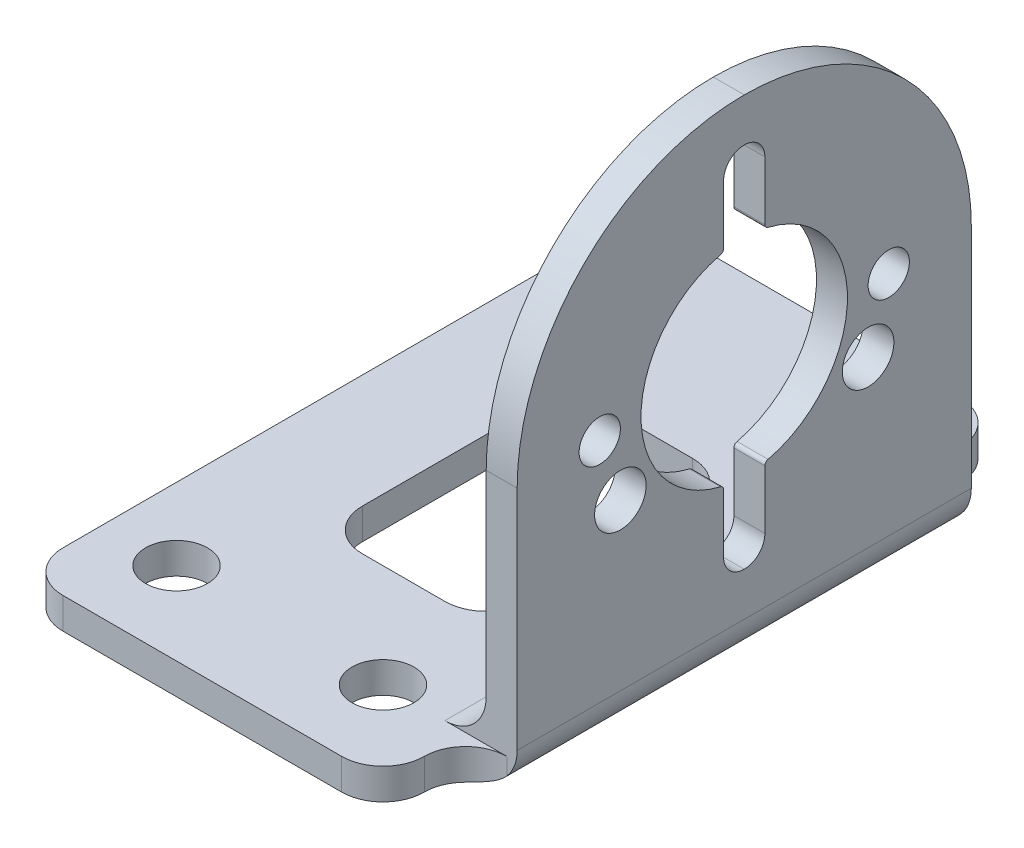
from build123d import *

# Parameters (mm, degrees)
EXTRUDE_1_DEPTH          = 30
CUT_EXTRUDE_1_DEPTH      = 30
CUT_EXTRUDE_1_DEPTH_BACK = 30
SKETCH_2_W               = 4.827470223
SKETCH_2_H               = 5.659354242
FILLET_1_R               = 11
SKETCH_3_R               = 1.5
CUT_EXTRUDE_2_DEPTH      = 30
SKETCH_4_R               = 1
SKETCH_4_R_2             = 1.25
CUT_EXTRUDE_3_DEPTH      = 43.640942766
FILLET_2_R               = 1
FILLET_3_R               = 0.2
FILLET_4_R               = 2
FILLET_5_R               = 2


# Some blends are built 0.0001 mm under size
with BuildPart() as part:
    # 草图1 → 凸台-拉伸1 (new body)
    with BuildSketch(Plane.XY):
        Polygon((0, 0), (18.5, 0), (20, 0), (20, 24), (18.5, 24), (18.5, 1.5), (0, 1.5), align=None)
    extrude(amount=EXTRUDE_1_DEPTH)

    # 草图2 → 切除-拉伸1 (cut, two sides: drawn at the far end of the back side and taken through both)
    with BuildSketch(Plane(origin=(0, 1.5, 0), x_dir=(1, 0, 0), z_dir=(0, 1, 0)).offset(-CUT_EXTRUDE_1_DEPTH_BACK)):
        with Locations((19.913735112, -1.170322879)):
            Rectangle(SKETCH_2_W, SKETCH_2_H)
        with Locations((19.913735112, -28.829677121)):
            Rectangle(SKETCH_2_W, SKETCH_2_H)
    extrude(amount=CUT_EXTRUDE_1_DEPTH + CUT_EXTRUDE_1_DEPTH_BACK, mode=Mode.SUBTRACT)

    # 圆角1
    fillet_1_edges = [part.edges().sort_by_distance(p)[0] for p in [
        (19.25, 24, 26),
        (19.25, 24, 4),
    ]]
    fillet(fillet_1_edges, radius=FILLET_1_R - 0.0001)  # a hair under: the kernel refuses the full size

    # 草图3 → 切除-拉伸2 (cut)
    with BuildSketch(Plane(origin=(0, 1.5, 0), x_dir=(1, 0, 0), z_dir=(0, 1, 0))):
        with Locations(Location((13.5, -4, 0), (0, 0, 270))):
            Circle(SKETCH_3_R)
        with Locations(Location((3.5, -4, 0), (0, 0, 270))):
            Circle(SKETCH_3_R)
        with Locations(Location((3.5, -26, 0), (0, 0, 270))):
            Circle(SKETCH_3_R)
        with Locations(Location((13.5, -26, 0), (0, 0, 270))):
            Circle(SKETCH_3_R)
        with BuildLine():
            Line((7.5, -9), (11.5, -9))
            ThreePointArc((11.5, -9), (12.914213562, -9.585786438), (13.5, -11))
            Line((13.5, -11), (13.5, -19))
            ThreePointArc((13.5, -19), (12.914213562, -20.414213562), (11.5, -21))
            Line((11.5, -21), (7.5, -21))
            ThreePointArc((7.5, -21), (6.085786438, -20.414213562), (5.5, -19))
            Line((5.5, -19), (5.5, -11))
            ThreePointArc((5.5, -11), (6.085786438, -9.585786438), (7.5, -9))
        make_face()
    extrude(amount=-CUT_EXTRUDE_2_DEPTH, mode=Mode.SUBTRACT)

    # 草图4 → 切除-拉伸3 (cut, through all)
    with BuildSketch(Plane.ZY.offset(-18.5)):
        with Locations((8, 13)):
            Circle(SKETCH_4_R)
        with Locations(Location((22, 13, 0), (0, 0, 180))):
            Circle(SKETCH_4_R)
        with Locations((9, 10)):
            Circle(SKETCH_4_R_2)
        with Locations(Location((21, 10, 0), (0, 0, 180))):
            Circle(SKETCH_4_R_2)
        with BuildLine():
            Line((16, 8.101020514), (16, 4.101020514))
            Line((16, 4.101020514), (14, 4.101020514))
            Line((14, 4.101020514), (14, 8.101020514))
            ThreePointArc((14, 8.101020514), (10, 13), (14, 17.898979486))
            Line((14, 17.898979486), (14, 21.898979486))
            Line((14, 21.898979486), (16, 21.898979486))
            Line((16, 21.898979486), (16, 17.898979486))
            ThreePointArc((16, 17.898979486), (20, 13), (16, 8.101020514))
        make_face()
    extrude(amount=-CUT_EXTRUDE_3_DEPTH, mode=Mode.SUBTRACT)

    # 圆角2
    fillet_2_edges = [part.edges().sort_by_distance(p)[0] for p in [
        (19.25, 4.101020514, 14),
        (19.25, 4.101020514, 16),
        (19.25, 21.898979486, 16),
        (19.25, 21.898979486, 14),
    ]]
    fillet(fillet_2_edges, radius=FILLET_2_R - 0.0001)  # a hair under: the kernel refuses the full size

    # 圆角3
    fillet_3_edges = [part.edges().sort_by_distance(p)[0] for p in [
        (19.25, 8.101020514, 14),
        (19.25, 17.898979486, 14),
        (19.25, 17.898979486, 16),
        (19.25, 8.101020514, 16),
    ]]
    fillet(fillet_3_edges, radius=FILLET_3_R)

    # 圆角4
    # the kernel refuses this fillet: 2 mm, written as the material it adds along each edge
    with BuildSketch(Plane(origin=(17.5, 0, 26), x_dir=(1, 0, 0), z_dir=(0, 1, 0))) as fillet_4_piece_1:
        with BuildLine():
            CenterArc((FILLET_4_R, -FILLET_4_R), FILLET_4_R, 90, 90)
            Line((0, -FILLET_4_R), (0, 0))
            Line((0, 0), (FILLET_4_R, 0))
        make_face()
    extrude(amount=1.5)
    with BuildSketch(Plane(origin=(17.5, 0, 4), x_dir=(1, 0, 0), z_dir=(0, 1, 0))) as fillet_4_piece_2:
        with BuildLine():
            CenterArc((FILLET_4_R, FILLET_4_R), FILLET_4_R, 180, 90)
            Line((0, FILLET_4_R), (0, 0))
            Line((0, 0), (FILLET_4_R, 0))
        make_face()
    extrude(amount=1.5)
    # the kernel refuses this fillet: 2 mm, written as the material it takes off along each edge
    with BuildSketch(Plane(origin=(17.5, 6.5, 0), x_dir=(0, 0, 1), z_dir=(0, -1, 0)), Plane(origin=(17.5, -5, 30), x_dir=(0, 0, -1), z_dir=(0, 1, 0)), Plane(origin=(0, 6.5, 30), x_dir=(0, 0, -1), z_dir=(0, -1, 0)), Plane(origin=(0, 6.5, 0), x_dir=(1, 0, 0), z_dir=(0, -1, 0))) as fillet_4_2_piece_1:
        with BuildLine():
            CenterArc((FILLET_4_R, FILLET_4_R), FILLET_4_R, 180, 90)
            Line((0, FILLET_4_R), (0, 0))
            Line((0, 0), (FILLET_4_R, 0))
        make_face()
    extrude(amount=11.5, mode=Mode.SUBTRACT)

    # 圆角5
    fillet_5_edges = [part.edges().sort_by_distance(p)[0] for p in [
        (20, 0, 15),
        (18.5, 1.5, 15),
    ]]
    fillet(fillet_5_edges, radius=FILLET_5_R)


solid = part.part
